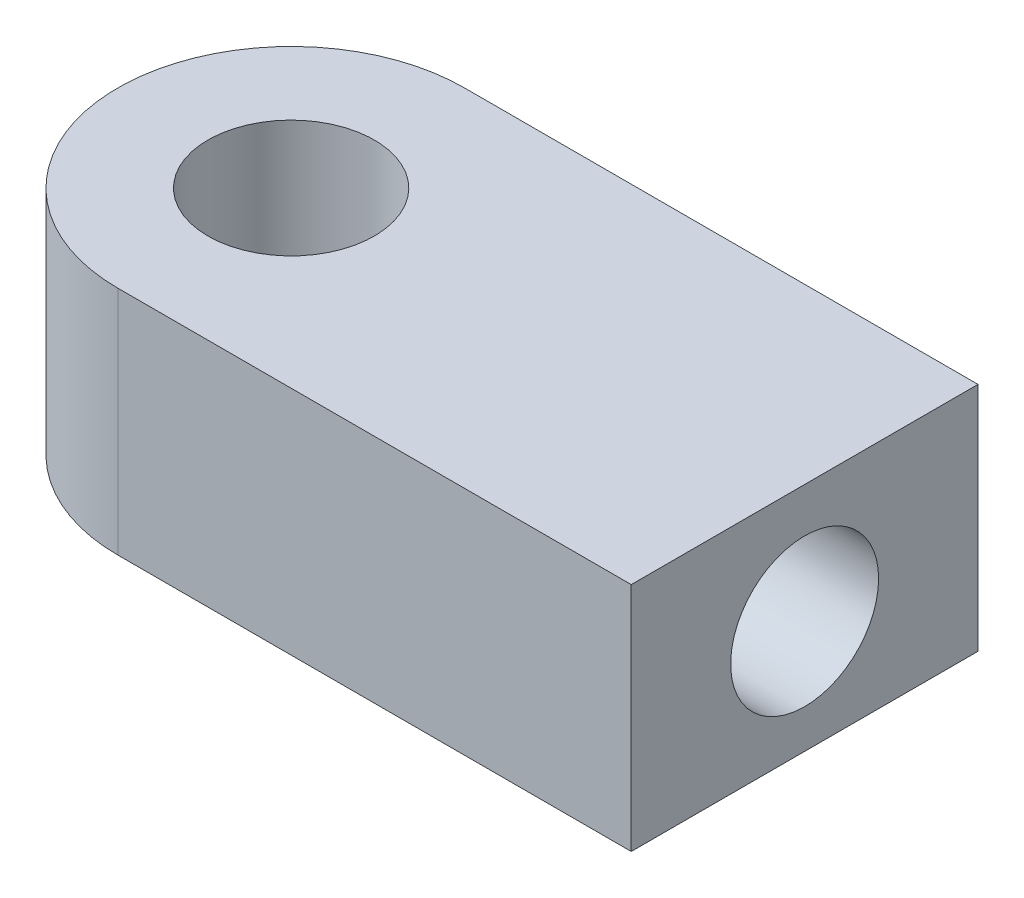
from build123d import *

# Parameters (mm, degrees)
SKETCH2_R           = 2.286
BOSS_EXTRUDE1_DEPTH = 6.35
SKETCH3_R           = 2.032
CUT_EXTRUDE1_DEPTH  = 9.525


with BuildPart() as part:
    # Sketch2 → Boss-Extrude1 (new body)
    with BuildSketch(Plane(origin=(0, 0, 0), x_dir=(1, 0, 0), z_dir=(0, 1, 0))):
        with BuildLine():
            Line((0, 4.7625), (14.105106383, 4.7625))
            Line((14.105106383, 4.7625), (14.105106383, -4.7625))
            Line((14.105106383, -4.7625), (0, -4.7625))
            ThreePointArc((0, -4.7625), (-4.7625, 0), (0, 4.7625))
        make_face()
        Circle(SKETCH2_R, mode=Mode.SUBTRACT)
    extrude(amount=BOSS_EXTRUDE1_DEPTH)

    # Sketch3 → Cut-Extrude1 (cut)
    with BuildSketch(Plane(origin=(14.105106383, 0, 0), x_dir=(0, 0, -1), z_dir=(1, 0, 0))):
        with Locations((0, 3.096088666)):
            Circle(SKETCH3_R)
    extrude(amount=-CUT_EXTRUDE1_DEPTH, mode=Mode.SUBTRACT)


solid = part.part
